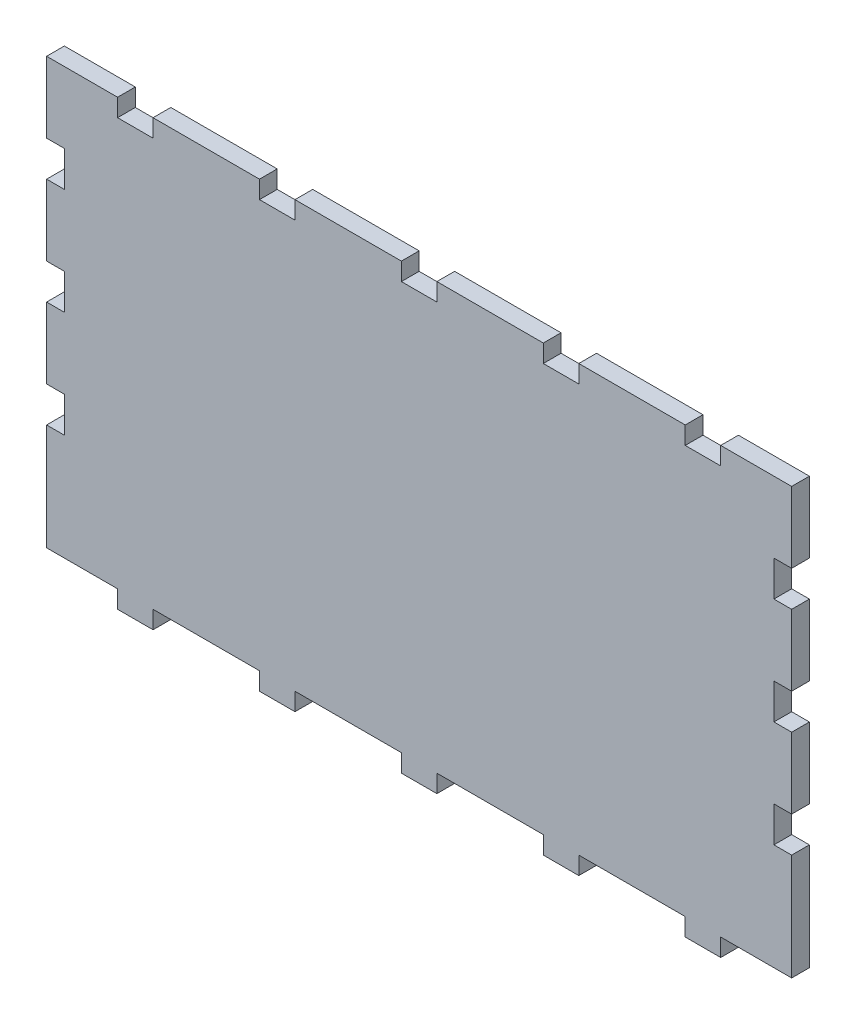
from build123d import *

# Parameters (mm, degrees)
BOSS_EXTRUDE1_DEPTH = 5


with BuildPart() as part:
    # Sketch1 → Boss-Extrude1 (new body)
    with BuildSketch(Plane.XY):
        Polygon((-85, 60), (-85, 55), (-75, 55), (-75, 60), (-45, 60), (-45, 55), (-35, 55), (-35, 60), (-5, 60), (-5, 55), (5, 55), (5, 60), (35, 60), (35, 55), (45, 55), (45, 60), (75, 60), (75, 55), (85, 55), (85, 60), (105, 60), (105, 40), (100, 40), (100, 30), (105, 30), (105, 10), (100, 10), (100, 0), (105, 0), (105, -20), (100, -20), (100, -30), (105, -30), (105, -60), (85, -60), (85, -65), (75, -65), (75, -60), (45, -60), (45, -65), (35, -65), (35, -60), (5, -60), (5, -65), (-5, -65), (-5, -60), (-35, -60), (-35, -65), (-45, -65), (-45, -60), (-75, -60), (-75, -65), (-85, -65), (-85, -60), (-105, -60), (-105, -30), (-100, -30), (-100, -20), (-105, -20), (-105, 0), (-100, 0), (-100, 10), (-105, 10), (-105, 30), (-100, 30), (-100, 40), (-105, 40), (-105, 60), align=None)
    extrude(amount=BOSS_EXTRUDE1_DEPTH)


solid = part.part
